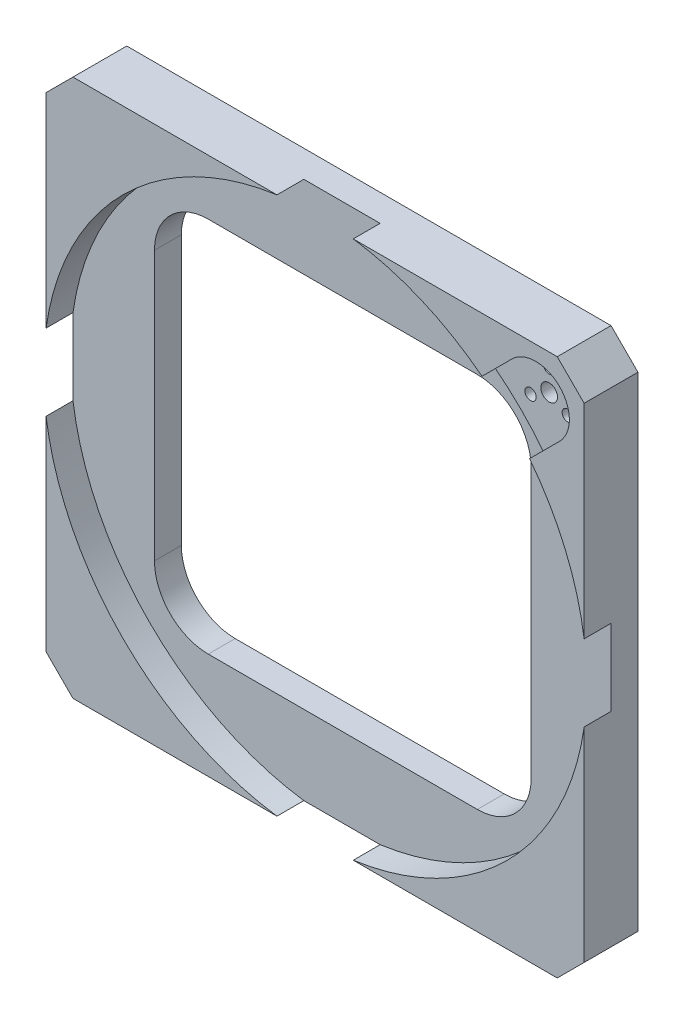
from build123d import *

# Parameters (mm, degrees)
SKETCH1_W              = 17.78
SKETCH1_H              = 17.78
EXTRUSION1_DEPTH       = 1.27
EXTRUSION2_DEPTH       = 1.27
SKETCH3_R              = 1.5875
EXTRUSION3_DEPTH       = 0.381
HOLE1_D                = 0.5334
HOLE2_D                = 0.7874
EXTRUSION4_START       = -0.635
EXTRUSION4_OUTLINE_R   = 0.2667
EXTRUSION4_OUTLINE_R_2 = 0.3937
EXTRUSION4_DEPTH       = 0.635
FILLET1_R              = 2.54


# Read off the part's stored shape, not the designer's step: Extrusion4
with BuildPart() as part:
    # Sketch1 → Extrusion1 (new body)
    with BuildSketch(Plane.XY):
        Polygon((12.7, 11.43), (11.43, 12.7), (-11.43, 12.7), (-12.7, 11.43), (-12.7, -11.43), (-11.43, -12.7), (11.43, -12.7), (12.7, -11.43), align=None)
        with Locations((0.037350374, -0.075564582)):
            Rectangle(SKETCH1_W, SKETCH1_H, mode=Mode.SUBTRACT)
    extrude(amount=EXTRUSION1_DEPTH)

    # Sketch2 → Extrusion2 (add)
    with BuildSketch(Plane.XY.offset(1.27)):
        with BuildLine():
            ThreePointArc((1.800535754, -12.7), (9.070058682, -9.070058682), (12.7, -1.800535754))
            Line((12.7, -1.800535754), (12.7, -11.43))
            Line((12.7, -11.43), (11.43, -12.7))
            Line((11.43, -12.7), (1.800535754, -12.7))
        make_face()
        with BuildLine():
            ThreePointArc((-12.7, -1.800535754), (-9.070058682, -9.070058682), (-1.800535754, -12.7))
            Line((-1.800535754, -12.7), (-11.43, -12.7))
            Line((-11.43, -12.7), (-12.7, -11.43))
            Line((-12.7, -11.43), (-12.7, -1.800535754))
        make_face()
        with BuildLine():
            ThreePointArc((-1.800535754, 12.7), (-9.070058682, 9.070058682), (-12.7, 1.800535754))
            Line((-12.7, 1.800535754), (-12.7, 11.43))
            Line((-12.7, 11.43), (-11.43, 12.7))
            Line((-11.43, 12.7), (-1.800535754, 12.7))
        make_face()
        with BuildLine():
            ThreePointArc((12.7, 1.800535754), (9.070058682, 9.070058682), (1.800535754, 12.7))
            Line((1.800535754, 12.7), (11.43, 12.7))
            Line((11.43, 12.7), (12.7, 11.43))
            Line((12.7, 11.43), (12.7, 1.800535754))
        make_face()
    extrude(amount=EXTRUSION2_DEPTH)

    # Sketch3 → Extrusion3 (cut)
    with BuildSketch(Plane(origin=(0, 0, 0), x_dir=(-1, 0, 0), z_dir=(0, 0, -1))):
        with Locations((-10.414, 10.414)):
            Circle(SKETCH3_R)
    extrude(amount=-EXTRUSION3_DEPTH, mode=Mode.SUBTRACT)

    # Hole1 (through all)
    with Locations(Plane(origin=(0, 0, 0.381), x_dir=(-1, 0, 0), z_dir=(0, 0, -1))):
        with Locations((-10.414, 11.43), (-11.29388181, 9.906), (-9.53411819, 9.906)):
            Hole(HOLE1_D / 2)

    # Hole2 (through all)
    with Locations(Plane(origin=(0, 0, 0.381), x_dir=(-1, 0, 0), z_dir=(0, 0, -1))):
        with Locations((-10.414, 10.414)):
            Hole(HOLE2_D / 2)

    # Extrusion4 outline → Extrusion4 (cut)
    with BuildSketch(Plane.XY.offset(2.54).offset(EXTRUSION4_START)):
        with BuildLine():
            ThreePointArc((11.518713485, 9.273649455), (11.536532015, 11.536532015), (9.27379199, 11.518573195))
            Line((9.27379199, 11.518573195), (7.877795, 10.12285903))
            ThreePointArc((7.877795, 10.12285903), (9.070058682, 9.070058682), (10.12285903, 7.877795))
            Line((10.12285903, 7.877795), (11.518713485, 9.273649455))
        make_face()
        with Locations((9.53411819, 9.906)):
            Circle(EXTRUSION4_OUTLINE_R, mode=Mode.SUBTRACT)
        with Locations((11.29388181, 9.906)):
            Circle(EXTRUSION4_OUTLINE_R, mode=Mode.SUBTRACT)
        with Locations((10.414, 10.414)):
            Circle(EXTRUSION4_OUTLINE_R_2, mode=Mode.SUBTRACT)
        with Locations((10.414, 11.43)):
            Circle(EXTRUSION4_OUTLINE_R, mode=Mode.SUBTRACT)
    extrude(amount=EXTRUSION4_DEPTH, mode=Mode.SUBTRACT)

    # Fillet1
    fillet1_edges = [part.edges().sort_by_distance(p)[0] for p in [
        (8.927350374, -8.965564582, 0.635),
        (8.927350374, 8.814435418, 0.635),
        (-8.852649626, 8.814435418, 0.635),
        (-8.852649626, -8.965564582, 0.635),
    ]]
    fillet(fillet1_edges, radius=FILLET1_R)


solid = part.part
